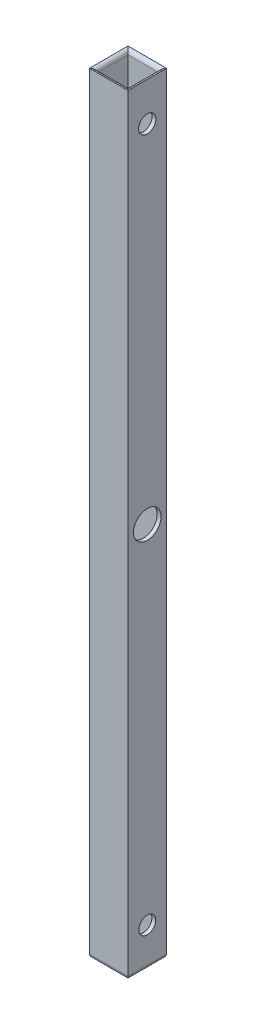
from build123d import *

# Parameters (mm, degrees)
SKETCH1_W           = 10
SKETCH1_H           = 10
BOSS_EXTRUDE2_DEPTH = 200
SKETCH3_W           = 8
SKETCH3_H           = 8
CUT_EXTRUDE1_DEPTH  = 200
SKETCH4_R           = 3.575
SKETCH4_R_2         = 2.25
SKETCH4_R_3         = 2.2
CUT_EXTRUDE2_DEPTH  = 201.31225624
FILLET1_R           = 1


with BuildPart() as part:
    # Sketch1 → Boss-Extrude2 (new body)
    with BuildSketch(Plane(origin=(0, 0, 0), x_dir=(1, 0, 0), z_dir=(0, 1, 0))):
        Rectangle(SKETCH1_W, SKETCH1_H)
    extrude(amount=BOSS_EXTRUDE2_DEPTH)

    # Sketch3 → Cut-Extrude1 (cut)
    with BuildSketch(Plane(origin=(0, 200, 0), x_dir=(1, 0, 0), z_dir=(0, 1, 0))):
        Rectangle(SKETCH3_W, SKETCH3_H)
    extrude(amount=-CUT_EXTRUDE1_DEPTH, mode=Mode.SUBTRACT)

    # Sketch4 → Cut-Extrude2 (cut, through all)
    with BuildSketch(Plane(origin=(5, 0, 0), x_dir=(0, 0, -1), z_dir=(1, 0, 0))):
        with Locations((0, 100)):
            Circle(SKETCH4_R)
        with Locations((0, 190)):
            Circle(SKETCH4_R_2)
        with Locations((0, 10)):
            Circle(SKETCH4_R_3)
    extrude(amount=-CUT_EXTRUDE2_DEPTH, mode=Mode.SUBTRACT)

    # Fillet1
    fillet1_edges = [part.edges().sort_by_distance(p)[0] for p in [
        (4, 200, 0),
        (0, 200, -4),
        (-4, 200, 0),
        (0, 200, 4),
        (0, 0, 5),
        (-5, 0, 0),
        (0, 0, -5),
        (5, 0, 0),
    ]]
    fillet(fillet1_edges, radius=FILLET1_R - 0.0001)  # a hair under: the kernel refuses the full size


solid = part.part
